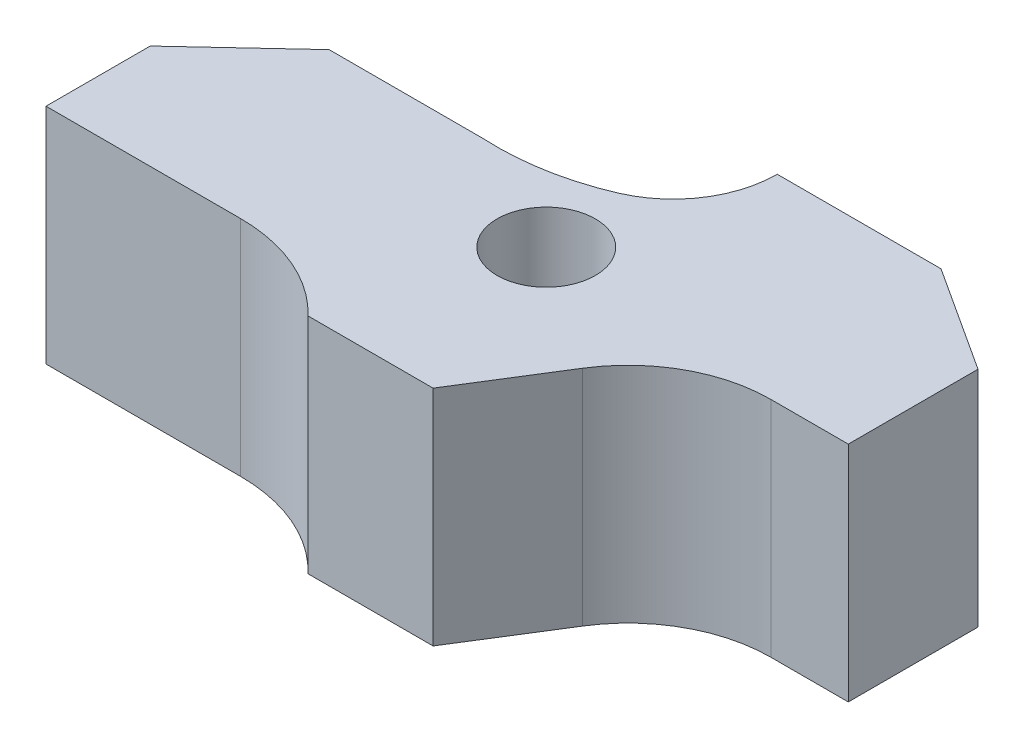
from build123d import *

# Parameters (mm, degrees)
SKETCH1_R           = 16.5
BOSS_EXTRUDE1_DEPTH = 75


with BuildPart() as part:
    # Sketch1 → Boss-Extrude1 (new body)
    with BuildSketch(Plane(origin=(0, 0, 0), x_dir=(1, 0, 0), z_dir=(0, 1, 0))):
        with BuildLine():
            Line((197.583105832, 103), (142.583105832, 103))
            ThreePointArc((142.583105832, 103), (136.806591565, 83.738954296), (121.383798311, 70.835720323))
            ThreePointArc((121.383798311, 70.835720323), (102.585086314, 65.210043589), (83, 64))
            Line((83, 64), (31.098692591, 64))
            Line((31.098692591, 64), (0, 35))
            Line((0, 35), (0, 0))
            Line((0, 0), (65.238209296, 0))
            ThreePointArc((65.238209296, 0), (86.859957606, -4.428268766), (105, -17))
            Line((105, -17), (147, -17))
            Line((147, -17), (166.293691384, 13.876360515))
            ThreePointArc((166.293691384, 13.876360515), (183.729138228, 30.421981775), (207, 36.440235832))
            Line((207, 36.440235832), (233, 36.440235832))
            Line((233, 36.440235832), (233, 80))
            Line((233, 80), (197.583105832, 103))
        make_face()
        with Locations((125, 43)):
            Circle(SKETCH1_R, mode=Mode.SUBTRACT)
    extrude(amount=BOSS_EXTRUDE1_DEPTH)


solid = part.part
